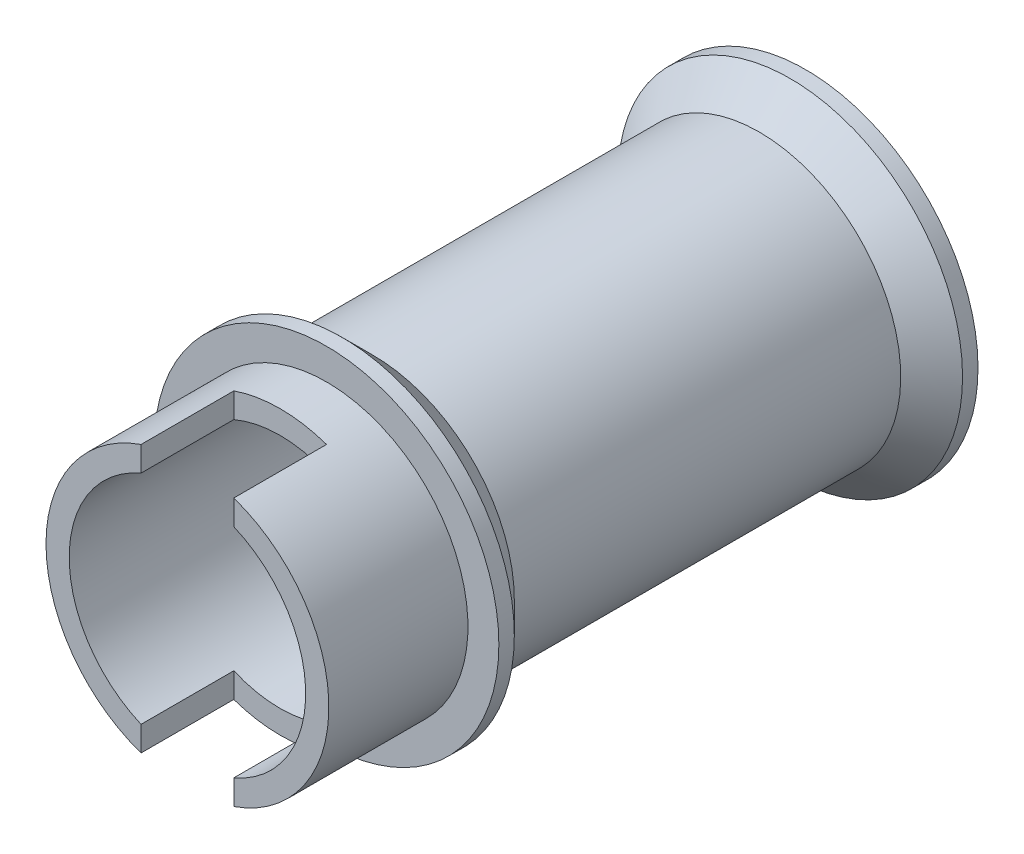
from build123d import *

# Parameters (mm, degrees)
SKETCH1_R           = 9.15
SKETCH1_R_2         = 7.65
BOSS_EXTRUDE1_DEPTH = 40
SKETCH2_W           = 6
SKETCH2_H           = 6
CUT_EXTRUDE1_DEPTH  = 15
SKETCH3_W           = 2
SKETCH3_H           = 3
CHAMFER1_SIZE       = 2
CUT_EXTRUDE2_DEPTH  = 5


with BuildPart() as part:
    # Sketch1 → Boss-Extrude1 (new body)
    with BuildSketch(Plane.XY):
        Circle(SKETCH1_R)
        Circle(SKETCH1_R_2, mode=Mode.SUBTRACT)
    extrude(amount=BOSS_EXTRUDE1_DEPTH)

    # Sketch2 → Cut-Extrude1 (cut, symmetric)
    with BuildSketch(Plane(origin=(0, 0, 0), x_dir=(1, 0, 0), z_dir=(0, 1, 0))):
        with Locations((0, -37)):
            Rectangle(SKETCH2_W, SKETCH2_H)
    extrude(amount=CUT_EXTRUDE1_DEPTH, both=True, mode=Mode.SUBTRACT)

    # Sketch3 → Revolve1 (revolve)
    with BuildSketch(Plane(origin=(0, 0, 0), x_dir=(1, 0, 0), z_dir=(0, 1, 0)), mode=Mode.PRIVATE) as revolve1_sk:
        with Locations((10.15, -29.5)):
            Rectangle(SKETCH3_W, SKETCH3_H)
        with Locations((10.15, -1.5)):
            Rectangle(SKETCH3_W, SKETCH3_H)
    revolve(revolve1_sk.sketch.rotate(Axis((0, 0, 0), (0, 0, 1)), 180), axis=Axis((0, 0, 0), (0, 0, 1)))

    # Chamfer1
    chamfer1_edges = [part.edges().sort_by_distance(p)[0] for p in [
        (11.15, 0, 28),
        (11.15, 0, 3),
    ]]
    chamfer(chamfer1_edges, length=CHAMFER1_SIZE - 0.0001)  # a hair under: the kernel refuses the full size

    # Sketch4 → Cut-Extrude2 (cut)
    with BuildSketch(Plane(origin=(0, 0, 0), x_dir=(-1, 0, 0), z_dir=(0, 0, -1))):
        with BuildLine():
            Line((0.5, -9.136328584), (0.609289617, -11.133340297))
            ThreePointArc((0.609289617, -11.133340297), (0, -11.15), (-0.609289617, -11.133340297))
            Line((-0.609289617, -11.133340297), (-0.5, -9.136328584))
            ThreePointArc((-0.5, -9.136328584), (0, -9.15), (0.5, -9.136328584))
        make_face()
    extrude(amount=-CUT_EXTRUDE2_DEPTH, mode=Mode.SUBTRACT)


solid = part.part
